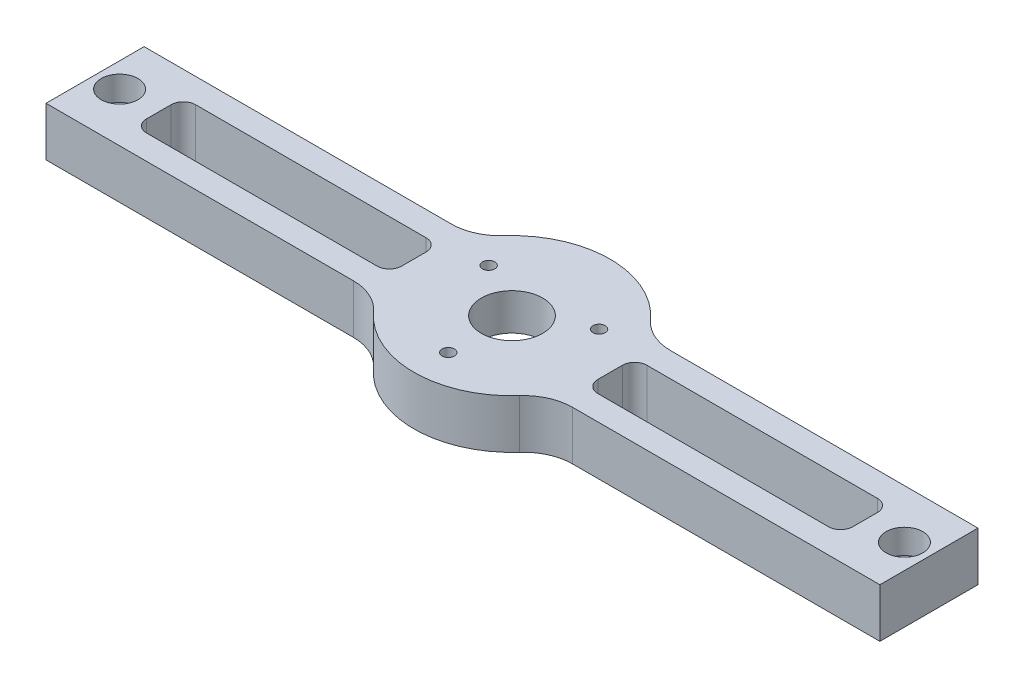
from build123d import *

# Parameters (mm, degrees)
SKETCH2_R           = 7.9375
BOSS_EXTRUDE1_DEPTH = 12.7
FILLET1_R           = 12.7
SKETCH3_R           = 22.225
CUT_EXTRUDE1_DEPTH  = 3.175
SKETCH4_R           = 4.7625
CUT_EXTRUDE2_DEPTH  = 6.35
SKETCH5_R           = 3.175
CUT_EXTRUDE3_DEPTH  = 115.652235041
SKETCH6_R           = 1.5875
CUT_EXTRUDE4_DEPTH  = 115.871833471
SKETCH7_W           = 66.04
SKETCH7_H           = 12.7
CUT_EXTRUDE5_DEPTH  = 116.178567885
FILLET2_R           = 3.175


with BuildPart() as part:
    # Sketch2 → Boss-Extrude1 (new body)
    with BuildSketch(Plane(origin=(0, 0, 0), x_dir=(1, 0, 0), z_dir=(0, 1, 0))):
        with BuildLine():
            Line((-107.95, 0), (-107.95, -25.4))
            Line((-107.95, -25.4), (-21.997045256, -25.4))
            ThreePointArc((-21.997045256, -25.4), (0, -38.1), (21.997045256, -25.4))
            Line((21.997045256, -25.4), (107.95, -25.4))
            Line((107.95, -25.4), (107.95, 0))
            Line((107.95, 0), (21.997045256, 0))
            ThreePointArc((21.997045256, 0), (0, 12.7), (-21.997045256, 0))
            Line((-21.997045256, 0), (-107.95, 0))
        make_face()
        with Locations((0, -12.7)):
            Circle(SKETCH2_R, mode=Mode.SUBTRACT)
    extrude(amount=BOSS_EXTRUDE1_DEPTH)

    # Fillet1
    fillet1_edges = [part.edges().sort_by_distance(p)[0] for p in [
        (21.997045256, 6.35, 0),
        (21.997045256, 6.35, 25.4),
        (-21.997045256, 6.35, 25.4),
        (-21.997045256, 6.35, 0),
    ]]
    fillet(fillet1_edges, radius=FILLET1_R)

    # Sketch3 → Cut-Extrude1 (cut)
    with BuildSketch(Plane.XZ):
        with Locations((0, 12.7)):
            Circle(SKETCH3_R)
    extrude(amount=-CUT_EXTRUDE1_DEPTH, mode=Mode.SUBTRACT)

    # Sketch4 → Cut-Extrude2 (cut)
    with BuildSketch(Plane(origin=(0, 12.7, 0), x_dir=(1, 0, 0), z_dir=(0, 1, 0))):
        with Locations((-101.6, -12.7)):
            Circle(SKETCH4_R)
        with Locations((101.6, -12.7)):
            Circle(SKETCH4_R)
    extrude(amount=-CUT_EXTRUDE2_DEPTH, mode=Mode.SUBTRACT)

    # Sketch5 → Cut-Extrude3 (cut, through all)
    with BuildSketch(Plane(origin=(0, 6.35, 0), x_dir=(1, 0, 0), z_dir=(0, 1, 0))):
        with Locations((-101.6, -12.7)):
            Circle(SKETCH5_R)
        with Locations((101.6, -12.7)):
            Circle(SKETCH5_R)
    extrude(amount=-CUT_EXTRUDE3_DEPTH, mode=Mode.SUBTRACT)

    # Sketch6 → Cut-Extrude4 (cut, through all)
    with BuildSketch(Plane.XZ.offset(-3.175)):
        with Locations((0, 29.21)):
            Circle(SKETCH6_R)
        with Locations((14.298079416, 4.445)):
            Circle(SKETCH6_R)
        with Locations((-14.298079416, 4.445)):
            Circle(SKETCH6_R)
    extrude(amount=-CUT_EXTRUDE4_DEPTH, mode=Mode.SUBTRACT)

    # Sketch7 → Cut-Extrude5 (cut, through all)
    with BuildSketch(Plane(origin=(0, 12.7, 0), x_dir=(1, 0, 0), z_dir=(0, 1, 0))):
        with Locations((-58.42, -12.7)):
            Rectangle(SKETCH7_W, SKETCH7_H)
        with Locations((58.42, -12.7)):
            Rectangle(SKETCH7_W, SKETCH7_H)
    extrude(amount=-CUT_EXTRUDE5_DEPTH, mode=Mode.SUBTRACT)

    # Fillet2
    fillet2_edges = [part.edges().sort_by_distance(p)[0] for p in [
        (25.4, 6.35, 6.35),
        (25.4, 6.35, 19.05),
        (91.44, 6.35, 19.05),
        (91.44, 6.35, 6.35),
        (-25.4, 6.35, 6.35),
        (-25.4, 6.35, 19.05),
        (-91.44, 6.35, 19.05),
        (-91.44, 6.35, 6.35),
    ]]
    fillet(fillet2_edges, radius=FILLET2_R)


solid = part.part
